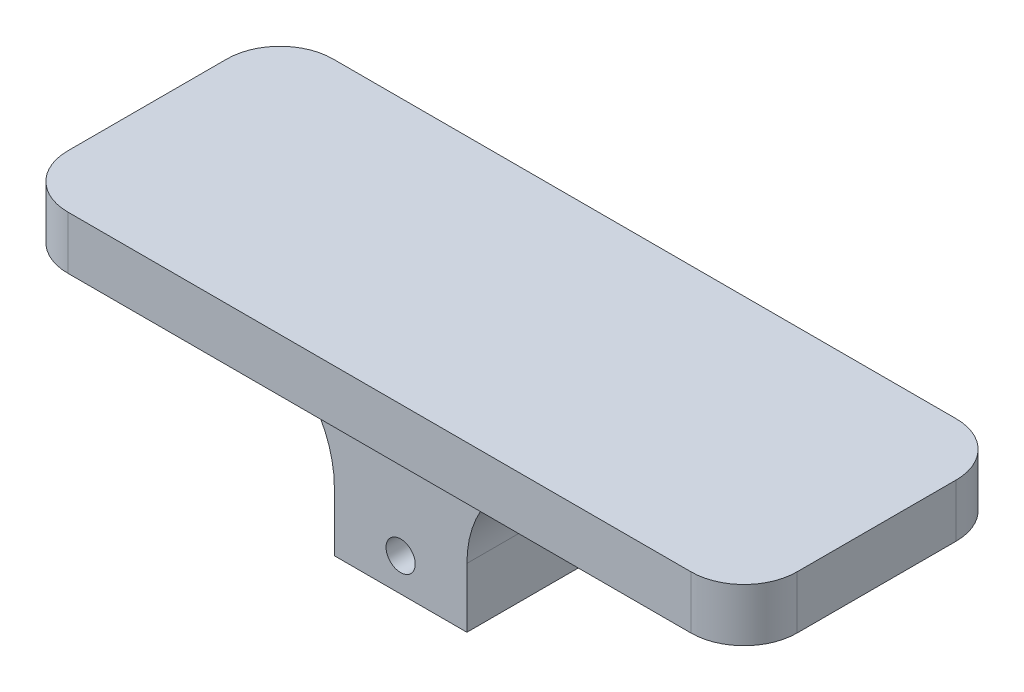
from build123d import *

# Parameters (mm, degrees)
SKETCH_1_W          = 55
SKETCH_1_H          = 20
EXTRUDE_1_DEPTH     = 4
SKETCH_2_R          = 3
CUT_EXTRUDE_1_DEPTH = 2.5
SKETCH_3_R          = 2
EXTRUDE_2_DEPTH     = 3.5
SKETCH_5_W          = 10
SKETCH_5_H          = 12.5
SKETCH_5_R          = 1.1
EXTRUDE_3_DEPTH     = 5.9
FILLET_1_R          = 8
FILLET_2_R          = 4


with BuildPart() as part:
    # 草图1 → 凸台-拉伸1 (new body)
    with BuildSketch(Plane(origin=(0, 0, 0), x_dir=(1, 0, 0), z_dir=(0, 1, 0))):
        Rectangle(SKETCH_1_W, SKETCH_1_H)
    extrude(amount=EXTRUDE_1_DEPTH)

    # 草图2 → 切除-拉伸1 (cut)
    with BuildSketch(Plane.XZ):
        with Locations((-22.5, 0)):
            Circle(SKETCH_2_R)
    extrude(amount=-CUT_EXTRUDE_1_DEPTH, mode=Mode.SUBTRACT)

    # 草图3 → 凸台-拉伸2 (add)
    with BuildSketch(Plane.XZ.offset(-2.5)):
        with Locations((-22.5, 0)):
            Circle(SKETCH_3_R)
    extrude(amount=EXTRUDE_2_DEPTH)

    # 草图5 → 凸台-拉伸3 (add, symmetric)
    with BuildSketch(Plane.XY):
        with Locations((-2.5, -6.25)):
            Rectangle(SKETCH_5_W, SKETCH_5_H)
        with Locations((-2.5, -10)):
            Circle(SKETCH_5_R, mode=Mode.SUBTRACT)
    extrude(amount=EXTRUDE_3_DEPTH, both=True)

    # 圆角1
    fillet_1_edges = [part.edges().sort_by_distance(p)[0] for p in [
        (2.5, 0, 0),
        (-7.5, 0, 0),
    ]]
    fillet(fillet_1_edges, radius=FILLET_1_R)

    # 圆角2
    fillet_2_edges = [part.edges().sort_by_distance(p)[0] for p in [
        (27.5, 2, -10),
        (27.5, 2, 10),
        (-27.5, 2, 10),
        (-27.5, 2, -10),
    ]]
    fillet(fillet_2_edges, radius=FILLET_2_R)


solid = part.part
